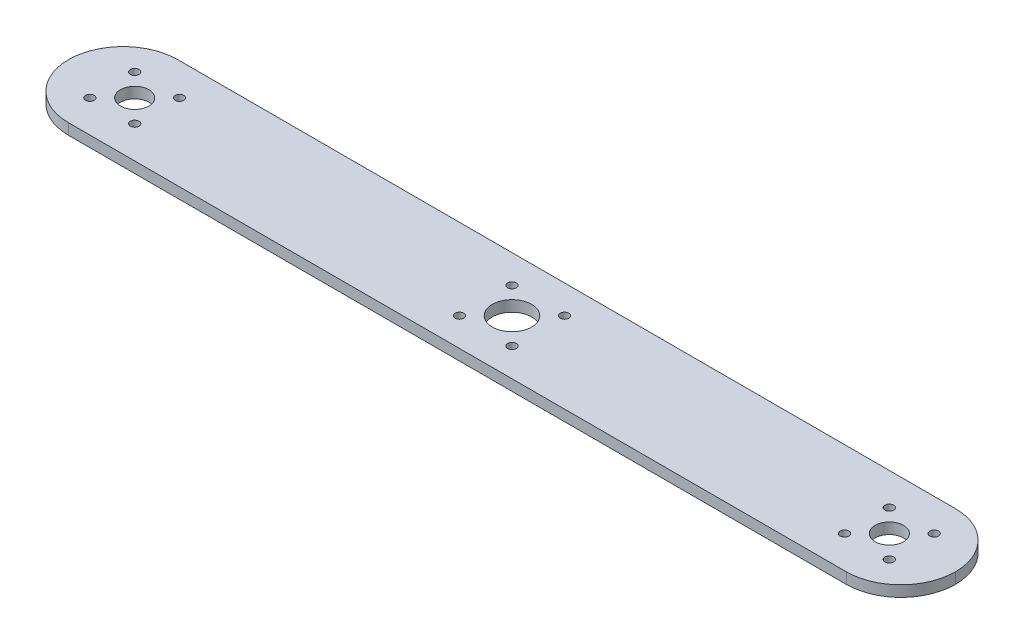
from build123d import *

# Parameters (mm, degrees)
SKETCH_1_W      = 406
SKETCH_1_H      = 50
SKETCH_1_R      = 6.5
SKETCH_1_R_2    = 9
SKETCH_1_R_3    = 2
EXTRUDE_1_DEPTH = 5
FILLET_1_R      = 25


with BuildPart() as part:
    # ｽｹｯﾁ1 → ﾎﾞｽ - 押し出し1 (new body)
    with BuildSketch(Plane(origin=(0, 0, 0), x_dir=(1, 0, 0), z_dir=(0, 1, 0))):
        Rectangle(SKETCH_1_W, SKETCH_1_H)
        with Locations(Location((172.7, 0, 0), (0, 0, 270))):
            Circle(SKETCH_1_R, mode=Mode.SUBTRACT)
        with Locations(Location((-172.7, 0, 0), (0, 0, 270))):
            Circle(SKETCH_1_R, mode=Mode.SUBTRACT)
        with Locations(Location((0, 0, 0), (0, 0, 270))):
            Circle(SKETCH_1_R_2, mode=Mode.SUBTRACT)
        with Locations(Location((12.02081528, 12.02081528, 0), (0, 0, 270))):
            Circle(SKETCH_1_R_3, mode=Mode.SUBTRACT)
        with Locations(Location((12.02081528, -12.02081528, 0), (0, 0, 270))):
            Circle(SKETCH_1_R_3, mode=Mode.SUBTRACT)
        with Locations(Location((-182.953048327, 10.253048327, 0), (0, 0, 270))):
            Circle(SKETCH_1_R_3, mode=Mode.SUBTRACT)
        with Locations(Location((182.953048327, 10.253048327, 0), (0, 0, 270))):
            Circle(SKETCH_1_R_3, mode=Mode.SUBTRACT)
        with Locations(Location((-182.953048327, -10.253048327, 0), (0, 0, 270))):
            Circle(SKETCH_1_R_3, mode=Mode.SUBTRACT)
        with Locations(Location((182.953048327, -10.253048327, 0), (0, 0, 270))):
            Circle(SKETCH_1_R_3, mode=Mode.SUBTRACT)
        with Locations(Location((-162.446951673, -10.253048327, 0), (0, 0, 270))):
            Circle(SKETCH_1_R_3, mode=Mode.SUBTRACT)
        with Locations(Location((-162.446951673, 10.253048327, 0), (0, 0, 270))):
            Circle(SKETCH_1_R_3, mode=Mode.SUBTRACT)
        with Locations(Location((-12.02081528, -12.02081528, 0), (0, 0, 270))):
            Circle(SKETCH_1_R_3, mode=Mode.SUBTRACT)
        with Locations(Location((162.446951673, -10.253048327, 0), (0, 0, 270))):
            Circle(SKETCH_1_R_3, mode=Mode.SUBTRACT)
        with Locations(Location((-12.02081528, 12.02081528, 0), (0, 0, 270))):
            Circle(SKETCH_1_R_3, mode=Mode.SUBTRACT)
        with Locations(Location((162.446951673, 10.253048327, 0), (0, 0, 270))):
            Circle(SKETCH_1_R_3, mode=Mode.SUBTRACT)
    extrude(amount=EXTRUDE_1_DEPTH)

    # ﾌｨﾚｯﾄ1
    fillet_1_edges = [part.edges().sort_by_distance(p)[0] for p in [
        (-203, 2.5, -25),
        (-203, 2.5, 25),
        (203, 2.5, 25),
        (203, 2.5, -25),
    ]]
    fillet(fillet_1_edges, radius=FILLET_1_R - 0.0001)  # a hair under: the kernel refuses the full size


solid = part.part
